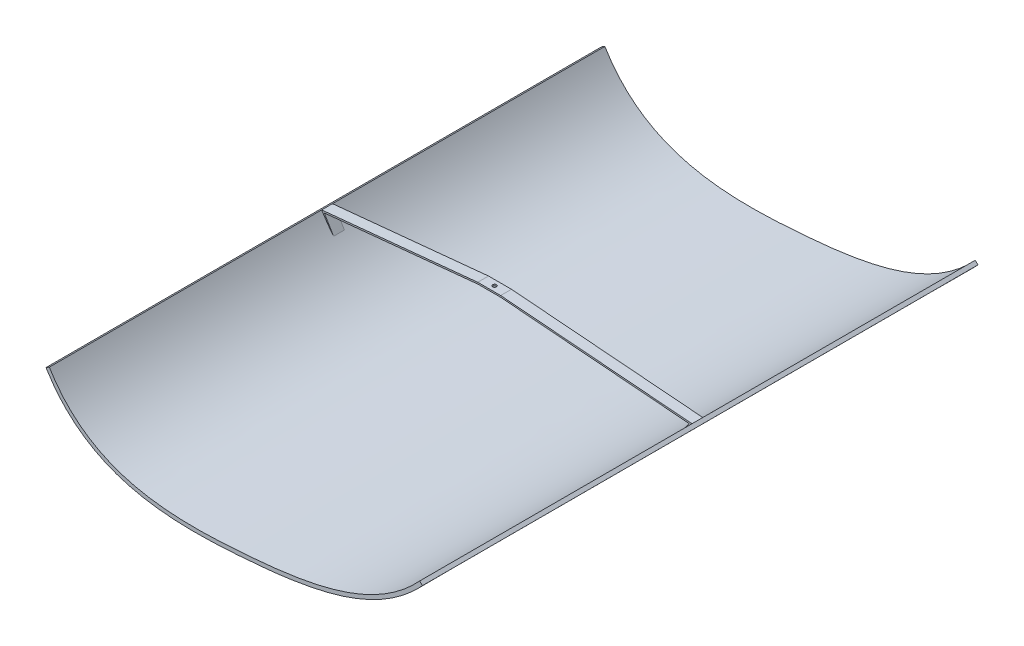
from build123d import *

# Parameters (mm, degrees)
EXTRUDE_THIN1_DEPTH      = 914.4
EXTRUDE_THIN4_DEPTH      = 8.89
EXTRUDE_THIN4_DEPTH_BACK = 8.89
SKETCH3_R                = 3.175
CUT_EXTRUDE1_DEPTH       = 2.54


# Read off the part's stored shape, not the designer's step: Extrude-Thin1
with BuildPart() as part:
    # Extrude-Thin1 outline → Extrude-Thin1 (new body)
    with BuildSketch(Plane.XY):
        with BuildLine():
            Line((-279.281860465, 0), (-284.71613549, -3.284989338))
            add(Edge.make_bspline(
                [(-284.71613549, -3.284989338), (-276.411980171, -17.022344077), (-267.229584336, -29.202445288), (-247.338960844, -50.724026352), (-236.631464335, -60.064270549), (-213.95664245, -76.199351518), (-201.990613754, -82.994245551), (-177.065513095, -94.373588626), (-164.106747152, -98.958909243), (-137.435337906, -106.278074265), (-123.722298844, -109.012434747), (-95.757540475, -112.988332753), (-81.50544134, -114.229947253), (-38.248820893, -116.240274168), (-8.742183636, -115.296775681), (27.950717972, -112.960198025), (35.278792072, -112.434976439), (49.893241244, -111.309686323), (57.188433916, -110.707434609), (79.013267611, -108.733315329), (93.482153818, -107.194182238), (136.449530574, -101.516065662), (164.51055488, -96.31826732), (204.929228546, -84.805234416), (218.123016692, -80.347603619), (243.810120822, -69.922590111), (256.303500739, -63.954946432), (280.436440477, -50.243453576), (292.075782995, -42.499330863), (314.337533524, -24.980842308), (324.959480174, -15.206510631), (334.991900126, -4.298658156)],
                knots=[0, 0, 0, 0, 0.0625, 0.0625, 0.125, 0.125, 0.1875, 0.1875, 0.25, 0.25, 0.3125, 0.3125, 0.375, 0.375, 0.5, 0.5, 0.53125, 0.53125, 0.5625, 0.5625, 0.625, 0.625, 0.75, 0.75, 0.8125, 0.8125, 0.875, 0.875, 0.9375, 0.9375, 1, 1, 1, 1], degree=3))
            Line((334.991900126, -4.298658156), (330.318139535, 0))
            add(Edge.make_bspline(
                [(-279.281860465, 0), (-210.683269989, -113.480918379), (31.412039024, -116.473776402), (256.595063057, -80.156178281), (330.318139535, 0)],
                knots=[0, 0, 0, 0, 0.529840137, 1, 1, 1, 1], degree=3))
        make_face()
    extrude(amount=EXTRUDE_THIN1_DEPTH)

    # Sketch2 → Extrude-Thin4 (add, two sides: drawn at the far end of the back side and taken through both)
    with BuildSketch(Plane.XY.offset(457.2).offset(-EXTRUDE_THIN4_DEPTH_BACK)):
        Polygon((-259.425934823, -32.895811523), (-279.281860465, 0), (-22.402060356, 25.301754569), (15.394596297, 25.301754569), (330.318139535, 0), (318.3059636, -16.837453823), (316.23823425, -15.362294396), (325.647772165, -2.172955429), (15.292725411, 22.761754569), (-22.277271764, 22.761754569), (-275.027395985, -2.133241486), (-257.251364532, -31.583239983), align=None)
    extrude(amount=EXTRUDE_THIN4_DEPTH + EXTRUDE_THIN4_DEPTH_BACK)

    # Sketch3 → Cut-Extrude1 (cut)
    with BuildSketch(Plane(origin=(0, 25.301754569, 0), x_dir=(1, 0, 0), z_dir=(0, 1, 0))):
        with Locations(Location((-3.503732029, -457.2, 0), (0, 0, 270))):
            Circle(SKETCH3_R)
    extrude(amount=-CUT_EXTRUDE1_DEPTH, mode=Mode.SUBTRACT)


solid = part.part
